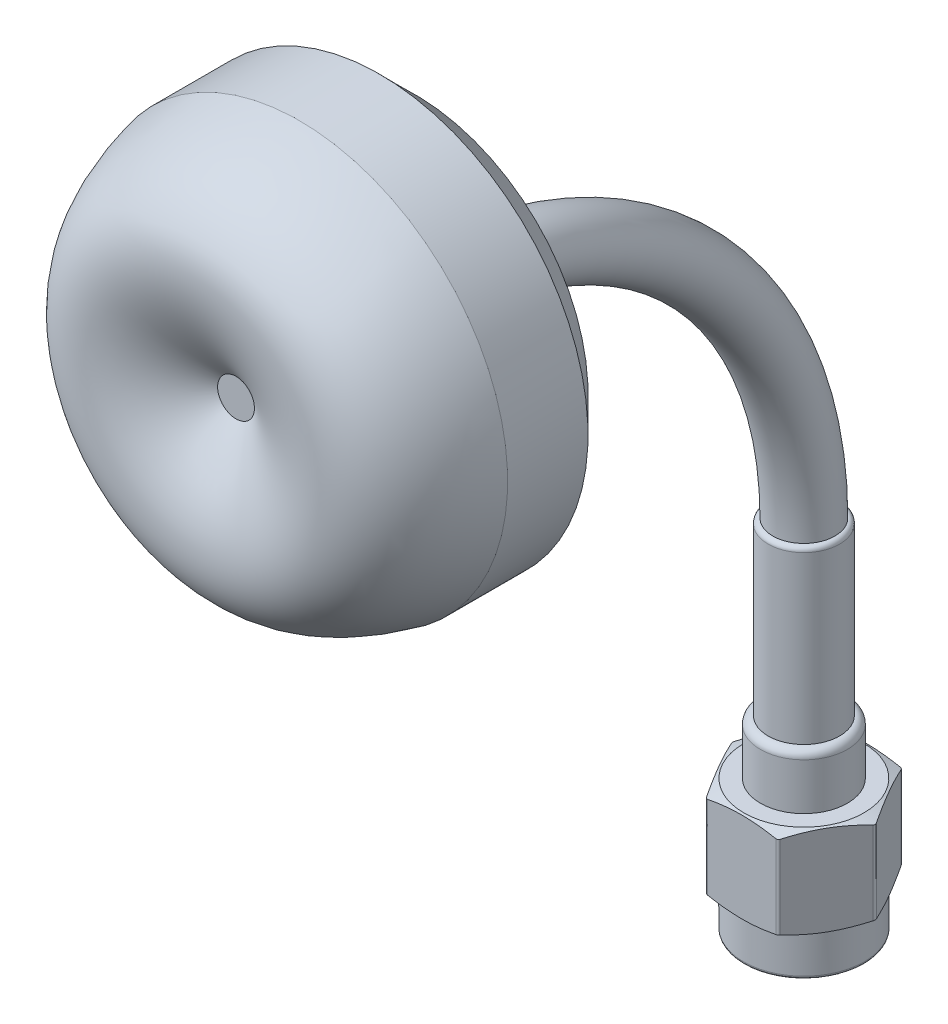
from build123d import *

# Parameters (mm, degrees)
SKETCH1_R           = 3.88
BOSS_EXTRUDE1_DEPTH = 2.6
BOSS_EXTRUDE2_DEPTH = 5.9
SKETCH3_R           = 3.25
CUT_EXTRUDE1_DEPTH  = 1
SKETCH4_R           = 2.85
SKETCH4_R_2         = 0.475
CUT_EXTRUDE2_DEPTH  = 2.45
SKETCH5_R           = 2.85
SKETCH5_R_2         = 2.6
CUT_EXTRUDE3_DEPTH  = 4
SKETCH6_R           = 2.5
SKETCH6_R_2         = 0.475
CUT_EXTRUDE4_DEPTH  = 0.1
THREAD1_PITCH       = 1
CHAMFER1_SIZE       = 1
CHAMFER1_SIZE2      = 0.363970234
FILLET1_R           = 0.2
SKETCH11_R          = 2.8
BOSS_EXTRUDE3_DEPTH = 3.5
SKETCH12_R          = 2.3
BOSS_EXTRUDE4_DEPTH = 11
SKETCH18_R          = 2
FILLET2_R           = 0.5
FILLET3_R           = 0.3


with BuildPart() as part:
    # Sketch1 → Boss-Extrude1 (new body)
    with BuildSketch(Plane(origin=(0, 0, 0), x_dir=(1, 0, 0), z_dir=(0, 1, 0))):
        with Locations(Location((0, 0, 0), (0, 0, 270))):
            Circle(SKETCH1_R)
    extrude(amount=BOSS_EXTRUDE1_DEPTH)

    # Sketch2 → Boss-Extrude2 (add)
    with BuildSketch(Plane(origin=(0, 2.6, 0), x_dir=(1, 0, 0), z_dir=(0, 1, 0))):
        Polygon((-2.309401077, -4), (2.309401077, -4), (4.618802154, 0), (2.309401077, 4), (-2.309401077, 4), (-4.618802154, 0), align=None)
    extrude(amount=BOSS_EXTRUDE2_DEPTH)

    # Sketch3 → Cut-Extrude1 (cut)
    with BuildSketch(Plane.XZ):
        with Locations(Location((0, 0, 0), (0, 0, 270))):
            Circle(SKETCH3_R)
    extrude(amount=-CUT_EXTRUDE1_DEPTH, mode=Mode.SUBTRACT)

    # Sketch4 → Cut-Extrude2 (cut)
    with BuildSketch(Plane.XZ.offset(-1)):
        with Locations(Location((0, 0, 0), (0, 0, 270))):
            Circle(SKETCH4_R)
        with Locations(Location((0, 0, 0), (0, 0, 270))):
            Circle(SKETCH4_R_2, mode=Mode.SUBTRACT)
    extrude(amount=-CUT_EXTRUDE2_DEPTH, mode=Mode.SUBTRACT)

    # Sketch5 → Cut-Extrude3 (cut)
    with BuildSketch(Plane.XZ.offset(-3.45)):
        with Locations(Location((0, 0, 0), (0, 0, 270))):
            Circle(SKETCH5_R)
        with Locations(Location((0, 0, 0), (0, 0, 270))):
            Circle(SKETCH5_R_2, mode=Mode.SUBTRACT)
    extrude(amount=-CUT_EXTRUDE3_DEPTH, mode=Mode.SUBTRACT)

    # Sketch6 → Cut-Extrude4 (cut)
    with BuildSketch(Plane.XZ.offset(-3.45)):
        with Locations(Location((0, 0, 0), (0, 0, 270))):
            Circle(SKETCH6_R)
        with Locations(Location((0, 0, 0), (0, 0, 270))):
            Circle(SKETCH6_R_2, mode=Mode.SUBTRACT)
    extrude(amount=-CUT_EXTRUDE4_DEPTH, mode=Mode.SUBTRACT)

    # Thread1: the profile of Thread Profile1 profile screwed along a right-hand helix of 7.45 turns, 8 arcs to a turn; built about Z, then put on its axis
    thread1_z = Axis((0, 0, 0), (0, 0, 1))
    thread1_corners = [(2.8497, 0, -0.000173205), (3.391265875, 0, 0.312499999), (3.391265875, 0, 0.437499999), (2.8497, 0, 0.750173202)]
    with BuildLine(mode=Mode.PRIVATE) as thread1_profile:
        Line(thread1_corners[0], thread1_corners[1])
        Line(thread1_corners[1], thread1_corners[2])
        Line(thread1_corners[2], thread1_corners[3])
        Line(thread1_corners[3], thread1_corners[0])
    thread1_cap = Face(thread1_profile.wire())
    thread1_turn_angles = [0, 22.5, 45, 67.5, 90, 112.5, 135, 157.5, 180, 202.5, 225, 247.5, 270, 292.5, 315, 337.5, 360]
    thread1_turn_weights = [1, 0.9238795325112867, 1, 0.9238795325112867, 1, 0.9238795325112867, 1, 0.9238795325112867, 1, 0.9238795325112867, 1, 0.9238795325112867, 1, 0.9238795325112867, 1, 0.9238795325112867, 1]
    thread1_turn_rails = [Edge.make_bspline([Vector(p[0], p[1], 0).rotate(thread1_z, thread1_turn_angles[k]) / thread1_turn_weights[k] + Vector(0, 0, p[2] + THREAD1_PITCH * thread1_turn_angles[k] / 360) for k in range(17)], [0, 0, 0, 1, 1, 2, 2, 3, 3, 4, 4, 5, 5, 6, 6, 7, 7, 8, 8, 8], 2, thread1_turn_weights) for p in thread1_corners]
    thread1_turn_sides = [Face.make_surface_from_curves(thread1_turn_rails[p[0]], thread1_turn_rails[p[1]]) for p in [(0, 1), (1, 2), (2, 3), (3, 0)]]
    thread1_last_angles = [2520, 2542.5, 2565, 2587.5, 2610, 2632.5, 2655, 2668.5, 2682]
    thread1_last_weights = [1, 0.9238795325112867, 1, 0.9238795325112867, 1, 0.9238795325112867, 1, 0.9723699203976766, 1]
    thread1_last_rails = [Edge.make_bspline([Vector(p[0], p[1], 0).rotate(thread1_z, thread1_last_angles[k]) / thread1_last_weights[k] + Vector(0, 0, p[2] + THREAD1_PITCH * thread1_last_angles[k] / 360) for k in range(9)], [0, 0, 0, 1, 1, 2, 2, 3, 3, 4, 4, 4], 2, thread1_last_weights) for p in thread1_corners]
    thread1_last_sides = [Face.make_surface_from_curves(thread1_last_rails[p[0]], thread1_last_rails[p[1]]) for p in [(0, 1), (1, 2), (2, 3), (3, 0)]]
    thread1 = Plane(origin=(0, 0, 0), x_dir=(1, 0, 0), z_dir=(0, 1, 0)) * Solid(Shell([*[p.moved(Location((0, 0, THREAD1_PITCH * i))) for i in range(7) for p in thread1_turn_sides], *thread1_last_sides, thread1_cap, thread1_cap.rotate(thread1_z, 2682).moved(Location((0, 0, THREAD1_PITCH * 2682 / 360)))]))
    add(thread1, mode=Mode.SUBTRACT)

    # Chamfer1
    chamfer1_edges = [part.edges().sort_by_distance(p)[0] for p in [
        (0, 1, 0.475),
    ]]
    chamfer1_side = [part.faces().sort_by_distance(p)[0] for p in [
        (0, 2.275, 0.475),
    ]]
    chamfer(chamfer1_edges, length=CHAMFER1_SIZE, length2=CHAMFER1_SIZE2, reference=chamfer1_side[0])

    # Sketch10 → Cut-Revolve1 (revolve, cut)
    with BuildSketch(Plane(origin=(0, 0, 0), x_dir=(0.49999999999999994, 0, 0.8660254037844387), z_dir=(-0.8660254037844386, 0, 0.4999999999999999)), mode=Mode.PRIVATE) as cut_revolve1_sk:
        Polygon((-3.868802154, 8.5), (-4.618802154, 8.2), (-4.618802154, 8.5), align=None)
        Polygon((-4.618802154, 2.9), (-4.618802154, 2.6), (-3.868802154, 2.6), align=None)
    revolve(cut_revolve1_sk.sketch.rotate(Axis((0, 2.6, 0), (0, -1, 0)), 30), axis=Axis((0, 2.6, 0), (0, -1, 0)), mode=Mode.SUBTRACT)

    # Fillet1
    fillet1_edges = [part.edges().sort_by_distance(p)[0] for p in [
        (4.618802154, 5.55, 0),
        (2.309401077, 5.55, -4),
        (-2.309401077, 5.55, -4),
        (0, 0, 3.25),
        (0, 0, -3.88),
        (2.309401077, 5.55, 4),
        (-2.309401077, 5.55, 4),
        (-4.618802154, 5.55, 0),
    ]]
    fillet(fillet1_edges, radius=FILLET1_R)

    # Sketch11 → Boss-Extrude3 (add)
    with BuildSketch(Plane(origin=(0, 8.5, 0), x_dir=(1, 0, 0), z_dir=(0, 1, 0))):
        with Locations(Location((0, 0, 0), (0, 0, 270))):
            Circle(SKETCH11_R)
    extrude(amount=BOSS_EXTRUDE3_DEPTH)

    # Sketch12 → Boss-Extrude4 (add)
    with BuildSketch(Plane(origin=(0, 12, 0), x_dir=(1, 0, 0), z_dir=(0, 1, 0))):
        with Locations(Location((0, 0, 0), (0, 0, 270))):
            Circle(SKETCH12_R)
    extrude(amount=BOSS_EXTRUDE4_DEPTH)

    # Sweep1: sweep along a path in Sketch17
    with BuildLine(Plane(origin=(0, 0, 0), x_dir=(0, 0, -1), z_dir=(1, 0, 0))) as sweep1_path:
        ThreePointArc((-25, 48), (-7.32233047, 40.67766953), (0, 23))
    # Sketch18 → Sweep1 (sweep)
    with BuildSketch(Plane(origin=(0, 23, 0), x_dir=(1, 0, 0), z_dir=(0, 1, 0))):
        Circle(SKETCH18_R)
    sweep(path=sweep1_path.line)

    # Fillet2
    fillet2_edges = [part.edges().sort_by_distance(p)[0] for p in [
        (0, 12, -2.8),
    ]]
    fillet(fillet2_edges, radius=FILLET2_R - 0.0001)  # a hair under: the kernel refuses the full size

    # Fillet3
    fillet3_edges = [part.edges().sort_by_distance(p)[0] for p in [
        (0, 23, -2.3),
    ]]
    fillet(fillet3_edges, radius=FILLET3_R - 0.0001)  # a hair under: the kernel refuses the full size

    # Sketch15 → Revolve1 (revolve)
    with BuildSketch(Plane(origin=(0, 48, 48), x_dir=(1, 0, 0), z_dir=(0, 1, 0))):
        with BuildLine():
            add(Edge.make_bspline(
                [(-13.4152516, 15.511202038), (-10.867571616, 4.476601045), (-1.18575286, 11.43797522)],
                knots=[0, 0, 0, 1, 1, 1], degree=2))
            Line((-1.18575286, 11.43797522), (0, 11.43797522))
            Line((0, 11.43797522), (0, 23))
            Line((0, 23), (-11.099723987, 23))
            Line((-11.099723987, 23), (-13.4152516, 20.684472386))
            Line((-13.4152516, 20.684472386), (-13.4152516, 15.511202038))
        make_face()
    revolve(axis=Axis((0, 48, 25), (0, 0, 1)))


solid = part.part
